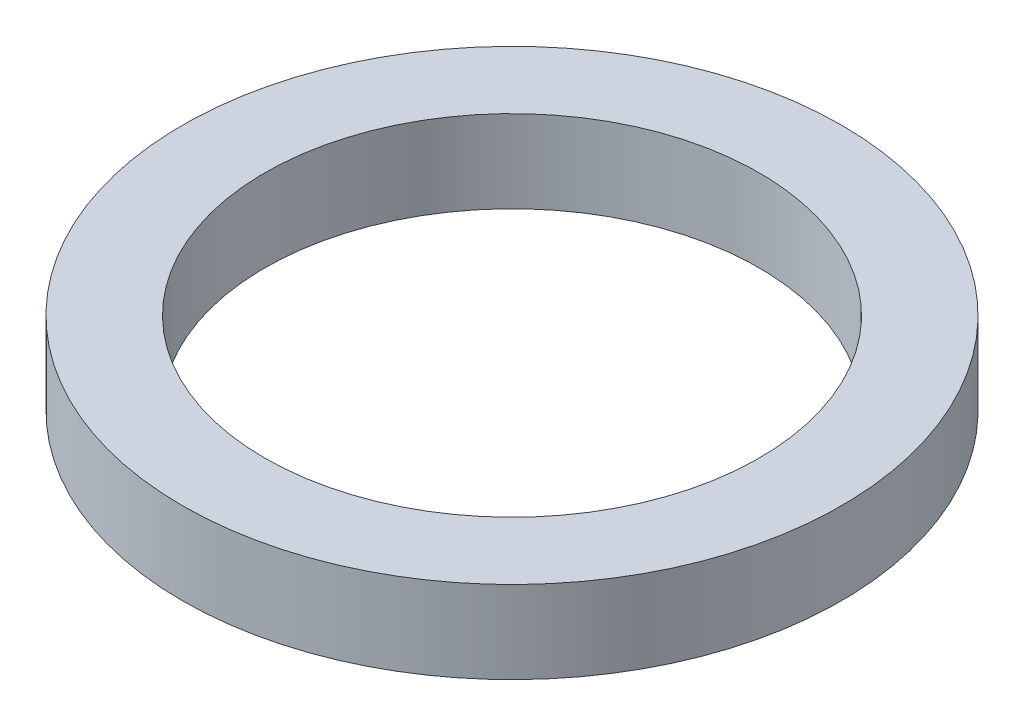
from build123d import *

# Parameters (mm, degrees)
SKETCH1_R           = 4
SKETCH1_R_2         = 3
BOSS_EXTRUDE1_DEPTH = 1


with BuildPart() as part:
    # Sketch1 → Boss-Extrude1 (new body)
    with BuildSketch(Plane(origin=(0, 0, 0), x_dir=(1, 0, 0), z_dir=(0, 1, 0))):
        Circle(SKETCH1_R)
        Circle(SKETCH1_R_2, mode=Mode.SUBTRACT)
    extrude(amount=BOSS_EXTRUDE1_DEPTH)


solid = part.part
